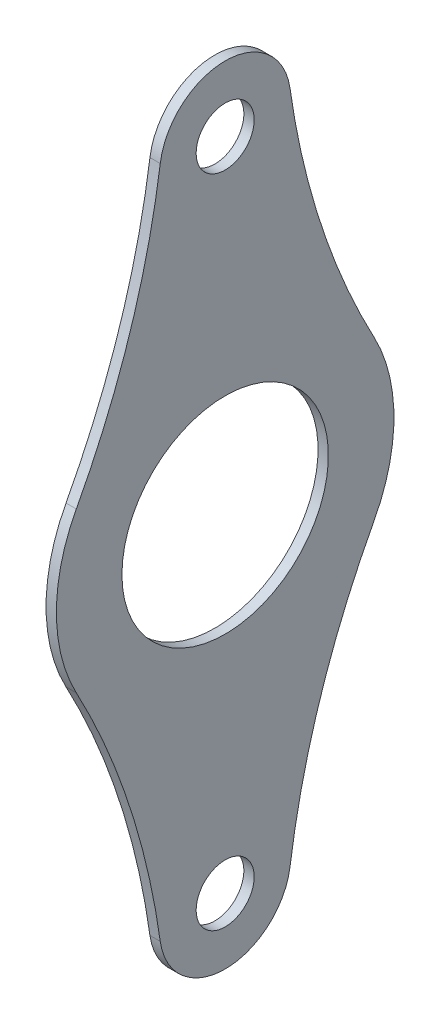
from build123d import *

# Parameters (mm, degrees)
SKETCH1_R           = 2.2479
SKETCH1_R_2         = 8.001
BOSS_EXTRUDE1_DEPTH = 0.8


with BuildPart() as part:
    # Sketch1 → Boss-Extrude1 (new body)
    with BuildSketch(Plane.ZY.offset(-56.0295)):
        with BuildLine():
            ThreePointArc((-11.535181474, 6.168642424), (-13.081, 0), (-11.535181474, -6.168642424))
            ThreePointArc((-11.535181474, -6.168642424), (-7.404701169, -15.851329634), (-5.030561789, -26.106999353))
            ThreePointArc((-5.030561789, -26.106999353), (0, -30.48), (5.030561789, -26.106999353))
            ThreePointArc((5.030561789, -26.106999353), (7.404701169, -15.851329634), (11.535181474, -6.168642424))
            ThreePointArc((11.535181474, -6.168642424), (13.081, 0), (11.535181474, 6.168642424))
            ThreePointArc((11.535181474, 6.168642424), (7.404701169, 15.851329634), (5.030561789, 26.106999353))
            ThreePointArc((5.030561789, 26.106999353), (0, 30.48), (-5.030561789, 26.106999353))
            ThreePointArc((-5.030561789, 26.106999353), (-7.404701169, 15.851329634), (-11.535181474, 6.168642424))
        make_face()
        with Locations((0, -25.4)):
            Circle(SKETCH1_R, mode=Mode.SUBTRACT)
        with Locations((0, 25.4)):
            Circle(SKETCH1_R, mode=Mode.SUBTRACT)
        Circle(SKETCH1_R_2, mode=Mode.SUBTRACT)
    extrude(amount=BOSS_EXTRUDE1_DEPTH)


solid = part.part
